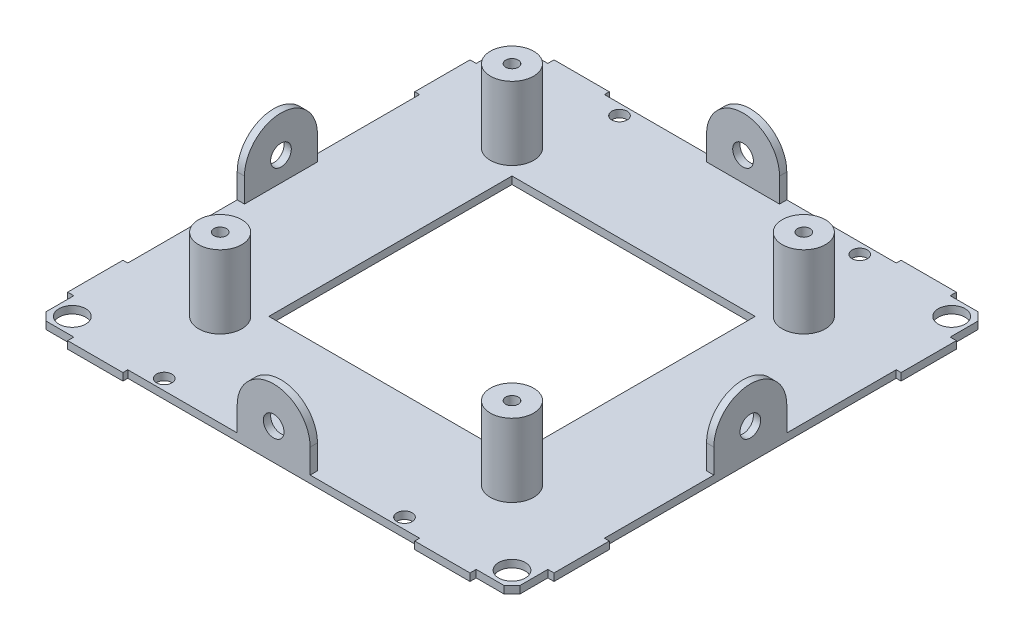
from build123d import *

# Parameters (mm, degrees)
SKETCH1_R                 = 2.7503
SKETCH1_R_2               = 1.575
SKETCH1_W                 = 50
SKETCH1_H                 = 50
BOSS_EXTRUDE1_DEPTH       = 1.524
SKETCH2_W                 = 15
SKETCH2_H                 = 2.5
SKETCH2_W_2               = 2.5
SKETCH2_H_2               = 15
BOSS_EXTRUDE2_DEPTH       = 12.476
CUT_EXTRUDE1_DEPTH        = 113.676528168
CUT_EXTRUDE1_DEPTH_BACK   = 113.676528168
SKETCH3_R                 = 2.125
CUT_EXTRUDE2_DEPTH        = 113.676528168
CUT_EXTRUDE2_DEPTH_BACK   = 113.676528168
SKETCH4_R                 = 2.125
CUT_EXTRUDE3_DEPTH        = 73.083285164
CUT_EXTRUDE3_DEPTH_BACK   = 73.083285164
SKETCH5_W                 = 60
SKETCH5_H                 = 1
SKETCH5_W_2               = 1
SKETCH5_H_2               = 60
SKETCH6_R                 = 4.445
BOSS_EXTRUDE3_DEPTH       = 15
F_5_40_TAPPED_HOLE1_D     = 2.5781
F_5_40_TAPPED_HOLE1_DEPTH = 15
F_5_40_TAPPED_HOLE1_TIP   = 0.774539381


with BuildPart() as part:
    # Sketch1 → Boss-Extrude1 (new body)
    with BuildSketch(Plane(origin=(0, 0, 0), x_dir=(1, 0, 0), z_dir=(0, 1, 0))):
        Polygon((41.364, 50), (-41.364, 50), (-41.364, 48.73), (-47.079, 48.73), (-48.73, 47.079), (-48.73, 41.364), (-50, 41.364), (-50, -41.364), (-48.73, -41.364), (-48.73, -47.079), (-47.079, -48.73), (-41.364, -48.73), (-41.364, -50), (41.364, -50), (41.364, -48.73), (47.079, -48.73), (48.73, -47.079), (48.73, -41.364), (50, -41.364), (50, 41.364), (48.73, 41.364), (48.73, 47.079), (47.079, 48.73), (41.364, 48.73), align=None)
        with Locations((-45.2, -45.2)):
            Circle(SKETCH1_R, mode=Mode.SUBTRACT)
        with Locations((-24.7, -46.8)):
            Circle(SKETCH1_R_2, mode=Mode.SUBTRACT)
        with Locations((24.7, -46.8)):
            Circle(SKETCH1_R_2, mode=Mode.SUBTRACT)
        with Locations((45.2, -45.2)):
            Circle(SKETCH1_R, mode=Mode.SUBTRACT)
        Rectangle(SKETCH1_W, SKETCH1_H, mode=Mode.SUBTRACT)
        with Locations((-45.2, 45.2)):
            Circle(SKETCH1_R, mode=Mode.SUBTRACT)
        with Locations((-24.7, 46.8)):
            Circle(SKETCH1_R_2, mode=Mode.SUBTRACT)
        with BuildLine():
            ThreePointArc((26.275, 46.8), (24.7, 45.225), (23.125, 46.8))
            ThreePointArc((23.125, 46.8), (24.7, 48.375), (26.275, 46.8))
        make_face(mode=Mode.SUBTRACT)
        with Locations((45.2, 45.2)):
            Circle(SKETCH1_R, mode=Mode.SUBTRACT)
    extrude(amount=BOSS_EXTRUDE1_DEPTH)

    # Sketch2 → Boss-Extrude2 (add)
    with BuildSketch(Plane(origin=(0, 1.524, 0), x_dir=(1, 0, 0), z_dir=(0, 1, 0))):
        with Locations((0, 48.75)):
            Rectangle(SKETCH2_W, SKETCH2_H)
        with Locations((48.75, 0)):
            Rectangle(SKETCH2_W_2, SKETCH2_H_2)
        with Locations((0, -48.75)):
            Rectangle(SKETCH2_W, SKETCH2_H)
        with Locations((-48.75, 0)):
            Rectangle(SKETCH2_W_2, SKETCH2_H_2)
    extrude(amount=BOSS_EXTRUDE2_DEPTH)

    # Sketch3 → Cut-Extrude1 (cut, two sides: drawn at the far end of the back side and taken through both)
    with BuildSketch(Plane.XY.offset(50).offset(-CUT_EXTRUDE1_DEPTH_BACK)):
        with BuildLine():
            ThreePointArc((0, 14), (5.303300859, 11.803300859), (7.5, 6.5))
            Line((7.5, 6.5), (7.5, 14))
            Line((7.5, 14), (0, 14))
        make_face()
        with BuildLine():
            ThreePointArc((-7.5, 6.5), (-5.303300859, 11.803300859), (0, 14))
            Line((0, 14), (-7.5, 14))
            Line((-7.5, 14), (-7.5, 6.5))
        make_face()
        with Locations((0, 6.5)):
            Circle(SKETCH3_R)
    extrude(amount=CUT_EXTRUDE1_DEPTH + CUT_EXTRUDE1_DEPTH_BACK, mode=Mode.SUBTRACT)

    # Sketch4 → Cut-Extrude2 (cut, two sides: drawn at the far end of the back side and taken through both)
    with BuildSketch(Plane.ZY.offset(50).offset(-CUT_EXTRUDE2_DEPTH_BACK)):
        with BuildLine():
            ThreePointArc((0, 14), (5.303300859, 11.803300859), (7.5, 6.5))
            Line((7.5, 6.5), (7.5, 14))
            Line((7.5, 14), (0, 14))
        make_face()
        with BuildLine():
            ThreePointArc((-7.5, 6.5), (-5.303300859, 11.803300859), (0, 14))
            Line((0, 14), (-7.5, 14))
            Line((-7.5, 14), (-7.5, 6.5))
        make_face()
        with Locations((0, 6.5)):
            Circle(SKETCH4_R)
    extrude(amount=CUT_EXTRUDE2_DEPTH + CUT_EXTRUDE2_DEPTH_BACK, mode=Mode.SUBTRACT)

    # Sketch5 → Cut-Extrude3 (cut, two sides: drawn at the far end of the back side and taken through both)
    with BuildSketch(Plane.XZ.offset(-CUT_EXTRUDE3_DEPTH_BACK)):
        with Locations((0, -49.5)):
            Rectangle(SKETCH5_W, SKETCH5_H)
        with Locations((-49.5, 0)):
            Rectangle(SKETCH5_W_2, SKETCH5_H_2)
        with Locations((0, 49.5)):
            Rectangle(SKETCH5_W, SKETCH5_H)
        with Locations((49.5, 0)):
            Rectangle(SKETCH5_W_2, SKETCH5_H_2)
    extrude(amount=CUT_EXTRUDE3_DEPTH + CUT_EXTRUDE3_DEPTH_BACK, mode=Mode.SUBTRACT)

    # Sketch6 → Boss-Extrude3 (add)
    with BuildSketch(Plane(origin=(0, 1.524, 0), x_dir=(1, 0, 0), z_dir=(0, 1, 0))):
        with Locations((30, 30)):
            Circle(SKETCH6_R)
        with Locations((30, -30)):
            Circle(SKETCH6_R)
        with Locations((-30, -30)):
            Circle(SKETCH6_R)
        with Locations((-30, 30)):
            Circle(SKETCH6_R)
    extrude(amount=BOSS_EXTRUDE3_DEPTH)

    # #5-40 Tapped Hole1
    with Locations(Plane(origin=(0, 16.524, 0), x_dir=(1, 0, 0), z_dir=(0, 1, 0))):
        with Locations((-17.222965343, 16.834933913), (-30, 30), (-30, -30), (30, -30), (30, 30)):
            Hole(F_5_40_TAPPED_HOLE1_D / 2, depth=F_5_40_TAPPED_HOLE1_DEPTH)
            with Locations((0, 0, -(F_5_40_TAPPED_HOLE1_DEPTH + F_5_40_TAPPED_HOLE1_TIP / 2))):  # 118° drill point
                Cone(0, F_5_40_TAPPED_HOLE1_D / 2, F_5_40_TAPPED_HOLE1_TIP, mode=Mode.SUBTRACT)


solid = part.part
